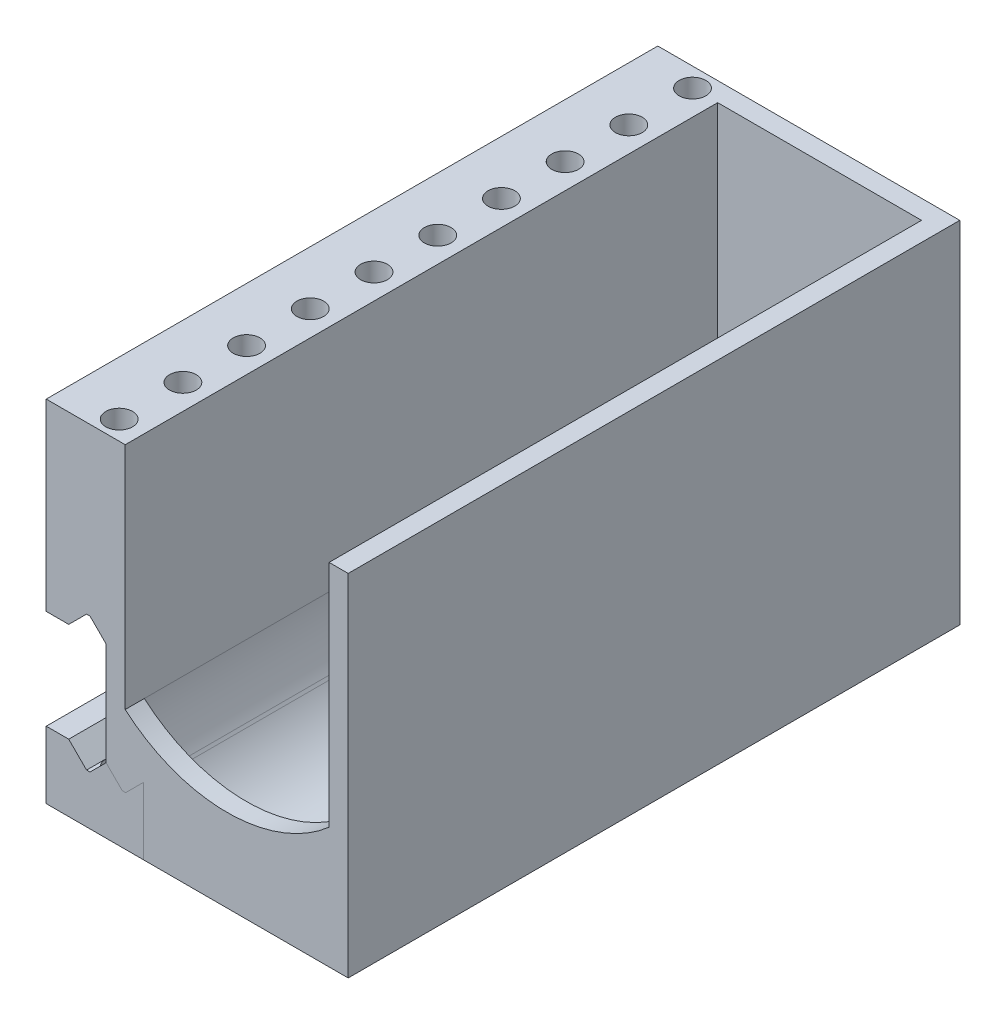
from build123d import *

# Parameters (mm, degrees)
BOSS_EXTRUDE1_DEPTH    = 90
SKETCH1_3_W            = 38
SKETCH1_3_H            = 55
BOSS_EXTRUDE2_DEPTH    = 3
BOSS_EXTRUDE3_DEPTH    = 3
SKETCH5_W              = 96
SKETCH5_H              = 55
BOSS_EXTRUDE5_DEPTH    = 9.4
CUT_EXTRUDE2_DEPTH     = 99.4
SKETCH6_R              = 2.1
CUT_EXTRUDE3_DEPTH     = 99.4
SPLIT1_SURFACE_1_BACK  = 121.365
SPLIT1_SURFACE_1_DEPTH = 242.73
SPLIT1_SURFACE_2_BACK  = 121.365
SPLIT1_SURFACE_2_DEPTH = 242.73


with BuildPart() as part:
    # Sketch1 → Boss-Extrude1 (new body)
    with BuildSketch(Plane.XY):
        with BuildLine():
            Line((0, 52), (0, 16))
            ThreePointArc((0, 16), (-16, 0), (-32, 16))
            Line((-32, 16), (-32, 52))
            Line((-32, 52), (-35, 52))
            Line((-35, 52), (-35, -3))
            Line((-35, -3), (3, -3))
            Line((3, -3), (3, 52))
            Line((3, 52), (0, 52))
        make_face()
    extrude(amount=BOSS_EXTRUDE1_DEPTH)

    # Sketch1<3> → Boss-Extrude2 (add)
    with BuildSketch(Plane.XY):
        with Locations((-16, 24.5)):
            Rectangle(SKETCH1_3_W, SKETCH1_3_H)
    extrude(amount=-BOSS_EXTRUDE2_DEPTH)

    # Sketch2 → Boss-Extrude3 (add)
    with BuildSketch(Plane.XY.offset(90)):
        with BuildLine():
            Line((-32, 16), (-32, 52))
            Line((-32, 52), (-35, 52))
            Line((-35, 52), (-35, -3))
            Line((-35, -3), (3, -3))
            Line((3, -3), (3, 52))
            Line((3, 52), (0, 52))
            Line((0, 52), (0, 16))
            ThreePointArc((0, 16), (-16, 10), (-32, 16))
        make_face()
    extrude(amount=BOSS_EXTRUDE3_DEPTH)

    # Sketch5 → Boss-Extrude5 (add)
    with BuildSketch(Plane.ZY.offset(35)):
        with Locations((45, 24.5)):
            Rectangle(SKETCH5_W, SKETCH5_H)
    extrude(amount=BOSS_EXTRUDE5_DEPTH)

    # Sketch4 → Cut-Extrude2 (cut)
    with BuildSketch(Plane(origin=(0, 0, -3), x_dir=(-1, 0, 0), z_dir=(0, 0, -1))):
        Polygon((38.07, 4.733333333), (40.87, 7.533333333), (44.4, 7.533333333), (44.4, 23.133333333), (40.87, 23.133333333), (38.07, 25.933333333), (37.53, 25.933333333), (35, 23.403333333), (35, 7.263333333), (37.53, 4.733333333), align=None)
    extrude(amount=-CUT_EXTRUDE2_DEPTH, mode=Mode.SUBTRACT)

    # Sketch6 → Cut-Extrude3 (cut)
    with BuildSketch(Plane.XZ.offset(3)):
        with Locations((-35.95, 0)):
            Circle(SKETCH6_R)
        with Locations((-35.95, 10)):
            Circle(SKETCH6_R)
        with Locations((-35.95, 20)):
            Circle(SKETCH6_R)
        with Locations((-35.95, 30)):
            Circle(SKETCH6_R)
        with Locations((-35.95, 40)):
            Circle(SKETCH6_R)
        with Locations((-35.95, 50)):
            Circle(SKETCH6_R)
        with Locations((-35.95, 60)):
            Circle(SKETCH6_R)
        with Locations((-35.95, 70)):
            Circle(SKETCH6_R)
        with Locations((-35.95, 80)):
            Circle(SKETCH6_R)
        with Locations((-35.95, 90)):
            Circle(SKETCH6_R)
    extrude(amount=-CUT_EXTRUDE3_DEPTH, mode=Mode.SUBTRACT)


with BuildPart() as body_2:
    # Split1: the piece behind the surface
    add(part.part)
    # Split1 surface: a surface, the sketch's curves swept straight by 242.73 mm
    with BuildLine(Plane(origin=(0, 0, -3), x_dir=(-1, 0, 0), z_dir=(0, 0, -1)).offset(-SPLIT1_SURFACE_1_BACK), mode=Mode.PRIVATE) as split1_surface_1_path:
        Line((44.4, 7.533333333), (40.87, 7.533333333))
        Line((40.87, 7.533333333), (38.07, 4.733333333))
        Line((38.07, 4.733333333), (37.53, 4.733333333))
        Line((37.53, 4.733333333), (35, 7.263333333))
        Line((35, 7.263333333), (32.47, 4.733333333))
        Line((32.47, 4.733333333), (31.93, 4.733333333))
        Line((31.93, 4.733333333), (29.13, 7.533333333))
        Line((29.13, 7.533333333), (29.13, -3))
    split1_surface_1 = Shell.extrude(split1_surface_1_path.wire(), (0 * SPLIT1_SURFACE_1_DEPTH, 0 * SPLIT1_SURFACE_1_DEPTH, -1 * SPLIT1_SURFACE_1_DEPTH))
    split(bisect_by=split1_surface_1, keep=Keep.BOTTOM)


with BuildPart() as part_1:
    add(part.part)

    # Split1: split by a surface, the side it looks to stays
    # Split1 surface: a surface, the sketch's curves swept straight by 242.73 mm
    with BuildLine(Plane(origin=(0, 0, -3), x_dir=(-1, 0, 0), z_dir=(0, 0, -1)).offset(-SPLIT1_SURFACE_2_BACK), mode=Mode.PRIVATE) as split1_surface_2_path:
        Line((44.4, 7.533333333), (40.87, 7.533333333))
        Line((40.87, 7.533333333), (38.07, 4.733333333))
        Line((38.07, 4.733333333), (37.53, 4.733333333))
        Line((37.53, 4.733333333), (35, 7.263333333))
        Line((35, 7.263333333), (32.47, 4.733333333))
        Line((32.47, 4.733333333), (31.93, 4.733333333))
        Line((31.93, 4.733333333), (29.13, 7.533333333))
        Line((29.13, 7.533333333), (29.13, -3))
    split1_surface_2 = Shell.extrude(split1_surface_2_path.wire(), (0 * SPLIT1_SURFACE_2_DEPTH, 0 * SPLIT1_SURFACE_2_DEPTH, -1 * SPLIT1_SURFACE_2_DEPTH))
    split(bisect_by=split1_surface_2, keep=Keep.TOP)


solid = Compound([body_2.part, part_1.part])
